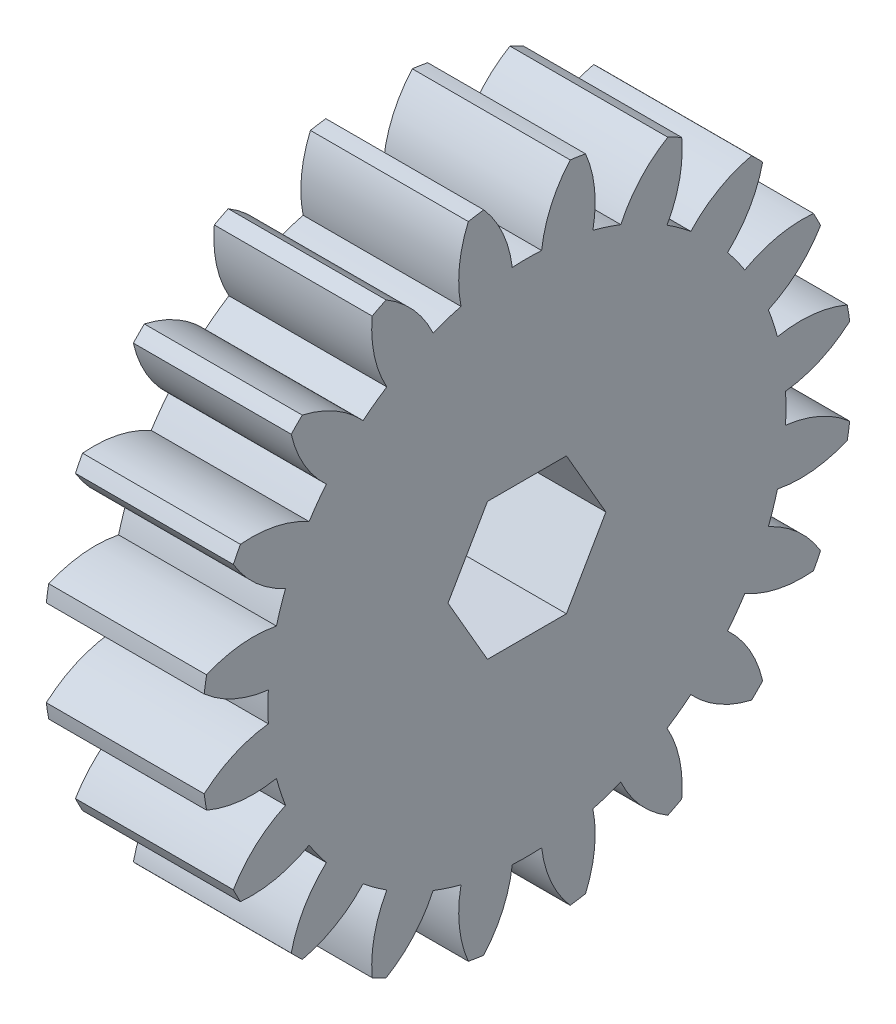
from build123d import *

# Parameters (mm, degrees)
BASPROSKE_W        = 8
BASPROSKE_H        = 16.5
TOOTHCUT_DEPTH     = 25.667792767
TEETHCUTS_COUNT    = 20
TEETHCUTS_ANGLE    = 342
BORSKE_R           = 2.5
BORE_DEPTH         = 50.0000508
CUT_EXTRUDE1_DEPTH = 25.472631648


with BuildPart() as part:
    # BasProSke → Base-Revolve (revolve)
    with BuildSketch(Plane(origin=(0, 0, 0), x_dir=(1, 0, 0), z_dir=(0, 1, 0))):
        with Locations((4, 8.25)):
            Rectangle(BASPROSKE_W, BASPROSKE_H)
    revolve(axis=Axis((-10, 0, 0), (1, 0, 0)))

    # TooCutSke → ToothCut (cut, through all)
    with BuildSketch(Plane(origin=(0, 0, 0), x_dir=(0, 0, -1), z_dir=(1, 0, 0))):
        with BuildLine():
            ThreePointArc((0.74381438, 13.102904875), (0, 13.124), (-0.74381438, 13.102904875))
            ThreePointArc((-0.74381438, 13.102904875), (-1.226473103, 14.852072512), (-2.209965745, 16.376962373))
            ThreePointArc((-2.209965745, 16.376962373), (0, 16.5254), (2.209965745, 16.376962373))
            ThreePointArc((2.209965745, 16.376962373), (1.226473103, 14.852072512), (0.74381438, 13.102904875))
        make_face()
    toothcut = extrude(amount=TOOTHCUT_DEPTH, mode=Mode.SUBTRACT)

    # TeethCuts: ToothCut ×20 about axis
    teethcuts_axis = Axis((-10, 0, 0), (1, 0, 0))
    for i in range(1, TEETHCUTS_COUNT):
        add(toothcut.rotate(teethcuts_axis, i * TEETHCUTS_ANGLE / (TEETHCUTS_COUNT - 1)), mode=Mode.SUBTRACT)

    # BorSke → Bore (cut, symmetric)
    with BuildSketch(Plane(origin=(0, 0, 0), x_dir=(0, 0, -1), z_dir=(1, 0, 0))):
        Circle(BORSKE_R)
    extrude(amount=BORE_DEPTH, both=True, mode=Mode.SUBTRACT)

    # Sketch1 → Cut-Extrude1 (cut, through all)
    with BuildSketch(Plane(origin=(8, 0, 0), x_dir=(0, 0, -1), z_dir=(1, 0, 0))):
        Polygon((4, 0), (2, 3.464101615), (-2, 3.464101615), (-4, 0), (-2, -3.464101615), (2, -3.464101615), align=None)
    extrude(amount=-CUT_EXTRUDE1_DEPTH, mode=Mode.SUBTRACT)


solid = part.part
